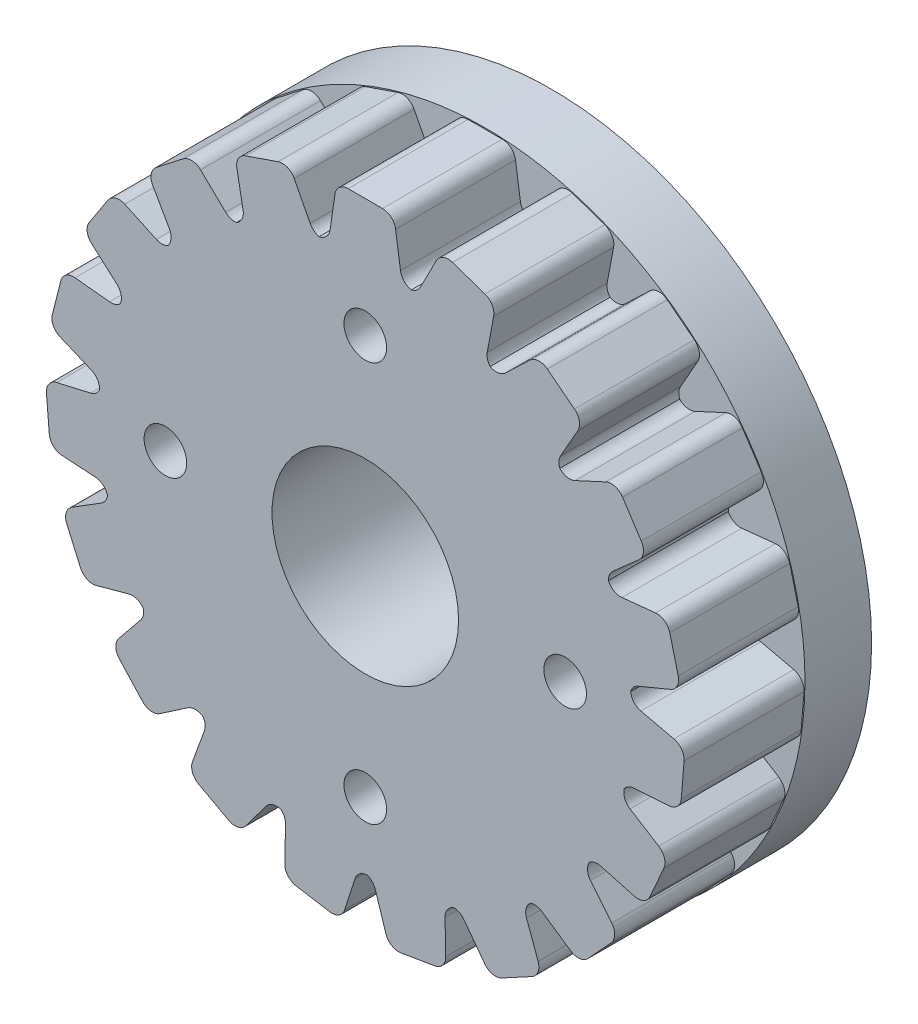
from build123d import *

# Parameters (mm, degrees)
SZKIC5_R                    = 24
DODANIE_WYCI_GNI_CIE3_DEPTH = 5
SZKIC6_R                    = 20
DODANIE_WYCI_GNI_CIE4_DEPTH = 9
DODANIE_WYCI_GNI_CIE5_REACH = 38.715
ZAOKR_GLENIE2_R             = 1
SZYK_START                  = 5
SZYK_KO_OWY3_DEPTH          = 9
SZKIC8_R                    = 7
WYTNIJ_WYCI_GNI_CIE3_DEPTH  = 10
SZKIC9_R                    = 1.6
WYTNIJ_WYCI_GNI_CIE4_DEPTH  = 37.71511967


# Read off the part's stored shape, not the designer's step: Szyk kołowy3
with BuildPart() as part:
    # Szkic5 → Dodanie-wyciągnięcie3 (new body)
    with BuildSketch(Plane.XY):
        Circle(SZKIC5_R)
    extrude(amount=DODANIE_WYCI_GNI_CIE3_DEPTH)

    # Szkic6 → Dodanie-wyciągnięcie4 (add)
    with BuildSketch(Plane.XY.offset(5)):
        Circle(SZKIC6_R)
    extrude(amount=DODANIE_WYCI_GNI_CIE4_DEPTH)

    # Szkic7 → Dodanie-wyciągnięcie5 (add, up to next)
    with BuildSketch(Plane.XY.offset(14), mode=Mode.PRIVATE) as dodanie_wyci_gni_cie5_sk1:
        with BuildLine():
            Line((-2.15, 23.903503927), (-2.75, 19.810035336))
            ThreePointArc((-2.75, 19.810035336), (0, 20), (2.75, 19.810035336))
            Line((2.75, 19.810035336), (2.15, 23.903503927))
            Line((2.15, 23.903503927), (-2.15, 23.903503927))
        make_face()
    dodanie_wyci_gni_cie5_tool1 = extrude(dodanie_wyci_gni_cie5_sk1.sketch, amount=-DODANIE_WYCI_GNI_CIE5_REACH, mode=Mode.PRIVATE) - part.part
    add(dodanie_wyci_gni_cie5_tool1.solids().sort_by_distance((0, 21.841189, 14))[0])

    # Zaokrąglenie2
    zaokr_glenie2_edges = [part.edges().sort_by_distance(p)[0] for p in [
        (-2.75, 19.810035336, 9.5),
        (-2.15, 23.903503927, 9.5),
        (2.15, 23.903503927, 9.5),
        (2.75, 19.810035336, 9.5),
    ]]
    fillet(zaokr_glenie2_edges, radius=ZAOKR_GLENIE2_R)

    # Szyk kołowy3 outline → Szyk kołowy3 (add)
    with BuildSketch(Plane.XY.offset(SZYK_START)):
        with BuildLine():
            ThreePointArc((3.459684979, 19.698491817), (6.493989384, 18.916344834), (9.368886528, 17.669860363))
            ThreePointArc((9.368886528, 17.669860363), (9.169998139, 18.057665281), (9.15495486, 18.493237257))
            Line((9.15495486, 18.493237257), (9.635880102, 21.060901891))
            ThreePointArc((9.635880102, 21.060901891), (9.517053985, 21.74835298), (8.97767191, 22.190818372))
            Line((8.97767191, 22.190818372), (6.545238164, 23.025873931))
            ThreePointArc((6.545238164, 23.025873931), (5.84782205, 23.008001894), (5.33181035, 22.538490903))
            Line((5.33181035, 22.538490903), (4.13423568, 20.216852329))
            ThreePointArc((4.13423568, 20.216852329), (3.854830575, 19.882364611), (3.459684979, 19.698491817))
        make_face()
        with BuildLine():
            ThreePointArc((9.368886528, 17.669860363), (12.149470554, 15.886798459), (14.598648694, 13.670386107))
            ThreePointArc((14.598648694, 13.670386107), (14.536456678, 14.10175764), (14.663658475, 14.518613669))
            Line((14.663658475, 14.518613669), (15.952245205, 16.79099898))
            ThreePointArc((15.952245205, 16.79099898), (16.063072418, 17.47978485), (15.696583829, 18.073413319))
            Line((15.696583829, 18.073413319), (13.66708815, 19.653033212))
            ThreePointArc((13.66708815, 19.653033212), (13.001656924, 19.862580173), (12.361154192, 19.586057308))
            Line((12.361154192, 19.586057308), (10.5290521, 17.831188775))
            ThreePointArc((10.5290521, 17.831188775), (9.975061969, 17.562883724), (9.368886528, 17.669860363))
        make_face()
        with BuildLine():
            ThreePointArc((14.598648694, 13.670386107), (16.649613754, 11.081081258), (18.246420753, 8.189513398))
            ThreePointArc((18.246420753, 8.189513398), (18.32766458, 8.617705746), (18.583327164, 8.97067301))
            Line((18.583327164, 8.97067301), (20.539937014, 10.70153079))
            ThreePointArc((20.539937014, 10.70153079), (20.86840771, 11.317010804), (20.714527333, 11.997473496))
            Line((20.714527333, 11.997473496), (19.307897069, 14.150481395))
            ThreePointArc((19.307897069, 14.150481395), (18.746560529, 14.56473969), (18.050975173, 14.511170494))
            Line((18.050975173, 14.511170494), (15.748336546, 13.446268155))
            ThreePointArc((15.748336546, 13.446268155), (15.13724462, 13.372380914), (14.598648694, 13.670386107))
        make_face()
        with BuildLine():
            ThreePointArc((18.246420753, 8.189513398), (19.345512959, 5.074556962), (19.916910001, 1.82117984))
            ThreePointArc((19.916910001, 1.82117984), (20.132785641, 2.199791718), (20.489204005, 2.450620736))
            Line((20.489204005, 2.450620736), (22.901807939, 3.452385688))
            ThreePointArc((22.901807939, 3.452385688), (23.41232722, 3.927863037), (23.487730381, 4.62142126))
            Line((23.487730381, 4.62142126), (22.856395746, 7.114505352))
            ThreePointArc((22.856395746, 7.114505352), (22.459983417, 7.688583667), (21.784692905, 7.863773193))
            Line((21.784692905, 7.863773193), (19.261044366, 7.60423574))
            ThreePointArc((19.261044366, 7.60423574), (18.659071938, 7.732773138), (18.246420753, 8.189513398))
        make_face()
        with BuildLine():
            ThreePointArc((19.916910001, 1.82117984), (19.945025658, -1.481874321), (19.429093008, -4.744506813))
            ThreePointArc((19.429093008, -4.744506813), (19.756206986, -4.456503876), (20.174757669, -4.334994319))
            Line((20.174757669, -4.334994319), (22.781912615, -4.170878973))
            ThreePointArc((22.781912615, -4.170878973), (23.419157796, -3.886929638), (23.715673393, -3.255433679))
            Line((23.715673393, -3.255433679), (23.928049292, -0.692437738))
            ThreePointArc((23.928049292, -0.692437738), (23.7395186, -0.020749698), (23.157701137, 0.364214048))
            Line((23.157701137, 0.364214048), (20.686519163, 0.938166391))
            ThreePointArc((20.686519163, 0.938166391), (20.158899287, 1.255199406), (19.916910001, 1.82117984))
        make_face()
        with BuildLine():
            ThreePointArc((19.429093008, -4.744506813), (18.383185348, -7.877721527), (16.835832314, -10.796052534))
            ThreePointArc((16.835832314, -10.796052534), (17.238736755, -10.629868126), (17.674063296, -10.650845476))
            Line((17.674063296, -10.650845476), (20.193243562, -11.342164179))
            ThreePointArc((20.193243562, -11.342164179), (20.888159239, -11.280513175), (21.373655206, -10.779511866))
            Line((21.373655206, -10.779511866), (22.406727414, -8.424344456))
            ThreePointArc((22.406727414, -8.424344456), (22.446508585, -7.727834511), (22.021213121, -7.174813341))
            Line((22.021213121, -7.174813341), (19.870288625, -5.829567843))
            ThreePointArc((19.870288625, -5.829567843), (19.4741971, -5.358394659), (19.429093008, -4.744506813))
        make_face()
        with BuildLine():
            ThreePointArc((16.835832314, -10.796052534), (14.829241661, -13.41989537), (12.418147953, -15.677678445))
            ThreePointArc((12.418147953, -15.677678445), (12.853181909, -15.651321225), (13.258109923, -15.812512261))
            Line((13.258109923, -15.812512261), (15.416323238, -17.284349905))
            ThreePointArc((15.416323238, -17.284349905), (16.093604516, -17.451678074), (16.715469831, -17.13546268))
            Line((16.715469831, -17.13546268), (18.457288945, -15.243342734))
            ThreePointArc((18.457288945, -15.243342734), (18.721071072, -14.597488544), (18.49838497, -13.936338376))
            Line((18.49838497, -13.936338376), (16.900803994, -11.965577947))
            ThreePointArc((16.900803994, -11.965577947), (16.679163484, -11.391323517), (16.835832314, -10.796052534))
        make_face()
        with BuildLine():
            ThreePointArc((12.418147953, -15.677678445), (9.668319541, -17.507815319), (6.654764575, -18.860384632))
            ThreePointArc((6.654764575, -18.860384632), (7.074785367, -18.976710813), (7.40543462, -19.260647986))
            Line((7.40543462, -19.260647986), (8.968805082, -21.353508124))
            ThreePointArc((8.968805082, -21.353508124), (9.555058025, -21.731682863), (10.245903933, -21.634520229))
            Line((10.245903933, -21.634520229), (12.507716825, -20.410488303))
            ThreePointArc((12.507716825, -20.410488303), (12.966915021, -19.885278191), (12.970969775, -19.187644903))
            Line((12.970969775, -19.187644903), (12.099855008, -16.804932016))
            ThreePointArc((12.099855008, -16.804932016), (12.0766837, -16.189825718), (12.418147953, -15.677678445))
        make_face()
        with BuildLine():
            ThreePointArc((6.654764575, -18.860384632), (3.459684979, -19.698491817), (0.170234196, -19.999275495))
            ThreePointArc((0.170234196, -19.999275495), (0.529726053, -20.245679332), (0.750265568, -20.621593642))
            Line((0.750265568, -20.621593642), (1.549377731, -23.108682404))
            ThreePointArc((1.549377731, -23.108682404), (1.981072735, -23.656722612), (2.666035361, -23.789141817))
            Line((2.666035361, -23.789141817), (5.202739509, -23.365840762))
            ThreePointArc((5.202739509, -23.365840762), (5.807592525, -23.018189394), (6.037948739, -22.359672378))
            Line((6.037948739, -22.359672378), (5.987698983, -19.823210944))
            ThreePointArc((5.987698983, -19.823210944), (6.165507849, -19.233909092), (6.654764575, -18.860384632))
        make_face()
        with BuildLine():
            ThreePointArc((0.170234196, -19.999275495), (-3.123860133, -19.754531072), (-6.3327437, -18.970934538))
            ThreePointArc((-6.3327437, -18.970934538), (-6.072737298, -19.32071435), (-5.986206399, -19.747869649))
            Line((-5.986206399, -19.747869649), (-6.037948739, -22.359672378))
            ThreePointArc((-6.037948739, -22.359672378), (-5.807592525, -23.018189394), (-5.202739509, -23.365840762))
            Line((-5.202739509, -23.365840762), (-2.666035361, -23.789141817))
            ThreePointArc((-2.666035361, -23.789141817), (-1.981072735, -23.656722612), (-1.549377731, -23.108682404))
            Line((-1.549377731, -23.108682404), (-0.773317135, -20.693337379))
            ThreePointArc((-0.773317135, -20.693337379), (-0.413796445, -20.19369997), (0.170234196, -19.999275495))
        make_face()
        with BuildLine():
            ThreePointArc((-6.3327437, -18.970934538), (-9.368886528, -17.669860363), (-12.149470554, -15.886798459))
            ThreePointArc((-12.149470554, -15.886798459), (-12.017125335, -16.302050177), (-12.073980018, -16.734157561))
            Line((-12.073980018, -16.734157561), (-12.970969775, -19.187644903))
            ThreePointArc((-12.970969775, -19.187644903), (-12.966915021, -19.885278191), (-12.507716825, -20.410488303))
            Line((-12.507716825, -20.410488303), (-10.245903933, -21.634520229))
            ThreePointArc((-10.245903933, -21.634520229), (-9.555058025, -21.731682863), (-8.968805082, -21.353508124))
            Line((-8.968805082, -21.353508124), (-7.450532343, -19.321019618))
            ThreePointArc((-7.450532343, -19.321019618), (-6.948259474, -18.96519012), (-6.3327437, -18.970934538))
        make_face()
        with BuildLine():
            ThreePointArc((-12.149470554, -15.886798459), (-14.598648694, -13.670386107), (-16.649613754, -11.081081258))
            ThreePointArc((-16.649613754, -11.081081258), (-16.659271377, -11.516805914), (-16.853350554, -11.907039843))
            Line((-16.853350554, -11.907039843), (-18.49838497, -13.936338376))
            ThreePointArc((-18.49838497, -13.936338376), (-18.721071072, -14.597488544), (-18.457288945, -15.243342734))
            Line((-18.457288945, -15.243342734), (-16.715469831, -17.13546268))
            ThreePointArc((-16.715469831, -17.13546268), (-16.093604516, -17.451678074), (-15.416323238, -17.284349905))
            Line((-15.416323238, -17.284349905), (-13.320366764, -15.854969585))
            ThreePointArc((-13.320366764, -15.854969585), (-12.729770776, -15.681507644), (-12.149470554, -15.886798459))
        make_face()
        with BuildLine():
            ThreePointArc((-16.649613754, -11.081081258), (-18.246420753, -8.189513399), (-19.345512959, -5.074556962))
            ThreePointArc((-19.345512959, -5.074556962), (-19.49612687, -5.48353703), (-19.806399052, -5.789609602))
            Line((-19.806399052, -5.789609602), (-22.021213121, -7.174813341))
            ThreePointArc((-22.021213121, -7.174813341), (-22.446508585, -7.727834511), (-22.406727414, -8.424344456))
            Line((-22.406727414, -8.424344456), (-21.373655206, -10.779511866))
            ThreePointArc((-21.373655206, -10.779511866), (-20.888159239, -11.280513175), (-20.193243562, -11.342164179))
            Line((-20.193243562, -11.342164179), (-17.74673276, -10.670787582))
            ThreePointArc((-17.74673276, -10.670787582), (-17.131813891, -10.698490492), (-16.649613754, -11.081081258))
        make_face()
        with BuildLine():
            ThreePointArc((-19.345512959, -5.074556962), (-19.916910001, -1.82117984), (-19.945025658, 1.481874321))
            ThreePointArc((-19.945025658, 1.481874321), (-20.220274503, 1.143958178), (-20.613116884, 0.955214675))
            Line((-20.613116884, 0.955214675), (-23.157701137, 0.364214048))
            ThreePointArc((-23.157701137, 0.364214048), (-23.7395186, -0.020749698), (-23.928049292, -0.692437738))
            Line((-23.928049292, -0.692437738), (-23.715673393, -3.255433679))
            ThreePointArc((-23.715673393, -3.255433679), (-23.419157796, -3.886929638), (-22.781912615, -4.170878973))
            Line((-22.781912615, -4.170878973), (-20.249964892, -4.330260171))
            ThreePointArc((-20.249964892, -4.330260171), (-19.677359144, -4.55612589), (-19.345512959, -5.074556962))
        make_face()
        with BuildLine():
            ThreePointArc((-19.945025658, 1.481874321), (-19.429093008, 4.744506813), (-18.383185348, 7.877721527))
            ThreePointArc((-18.383185348, 7.877721527), (-18.753241644, 7.647487767), (-19.186083656, 7.59652662))
            Line((-19.186083656, 7.59652662), (-21.784692905, 7.863773193))
            ThreePointArc((-21.784692905, 7.863773193), (-22.459983417, 7.688583667), (-22.856395746, 7.114505352))
            Line((-22.856395746, 7.114505352), (-23.487730381, 4.62142126))
            ThreePointArc((-23.487730381, 4.62142126), (-23.41232722, 3.927863037), (-22.901807939, 3.452385688))
            Line((-22.901807939, 3.452385688), (-20.558799117, 2.479518121))
            ThreePointArc((-20.558799117, 2.479518121), (-20.090557207, 2.079965647), (-19.945025658, 1.481874321))
        make_face()
        with BuildLine():
            ThreePointArc((-18.383185348, 7.877721527), (-16.835832314, 10.796052534), (-14.829241662, 13.419895371))
            ThreePointArc((-14.829241662, 13.419895371), (-15.254004065, 13.322293393), (-15.679940561, 13.414637033))
            Line((-15.679940561, 13.414637033), (-18.050975173, 14.511170494))
            ThreePointArc((-18.050975173, 14.511170494), (-18.746560529, 14.56473969), (-19.307897069, 14.150481395))
            Line((-19.307897069, 14.150481395), (-20.714527333, 11.997473496))
            ThreePointArc((-20.714527333, 11.997473496), (-20.86840771, 11.317010804), (-20.539937014, 10.70153079))
            Line((-20.539937014, 10.70153079), (-18.639768456, 9.020602151))
            ThreePointArc((-18.639768456, 9.020602151), (-18.326631661, 8.490660632), (-18.383185348, 7.877721527))
        make_face()
        with BuildLine():
            ThreePointArc((-14.829241662, 13.419895371), (-12.418147954, 15.677678445), (-9.668319541, 17.50781532))
            ThreePointArc((-9.668319541, 17.50781532), (-10.101758457, 17.553421813), (-10.474632608, 17.779063375))
            Line((-10.474632608, 17.779063375), (-12.361154192, 19.586057308))
            ThreePointArc((-12.361154192, 19.586057308), (-13.001656924, 19.862580173), (-13.66708815, 19.653033212))
            Line((-13.66708815, 19.653033212), (-15.696583829, 18.073413319))
            ThreePointArc((-15.696583829, 18.073413319), (-16.063072418, 17.47978485), (-15.952245205, 16.79099898))
            Line((-15.952245205, 16.79099898), (-14.700829657, 14.584163969))
            ThreePointArc((-14.700829657, 14.584163969), (-14.576731206, 13.981260792), (-14.829241662, 13.419895371))
        make_face()
        with BuildLine():
            Line((-9.635880102, 21.060901891), (-9.168827857, 18.567305324))
            ThreePointArc((-9.168827857, 18.567305324), (-9.247215745, 17.956774403), (-9.668319541, 17.507815319))
            ThreePointArc((-9.668319541, 17.507815319), (-6.654764575, 18.860384632), (-3.459684979, 19.698491817))
            ThreePointArc((-3.459684979, 19.698491817), (-3.854830575, 19.882364611), (-4.13423568, 20.216852329))
            Line((-4.13423568, 20.216852329), (-5.33181035, 22.538490903))
            ThreePointArc((-5.33181035, 22.538490903), (-5.84782205, 23.008001894), (-6.545238164, 23.025873931))
            Line((-6.545238164, 23.025873931), (-8.97767191, 22.190818372))
            ThreePointArc((-8.97767191, 22.190818372), (-9.517053985, 21.74835298), (-9.635880102, 21.060901891))
        make_face()
    extrude(amount=SZYK_KO_OWY3_DEPTH)

    # Szkic8 → Wytnij-wyciągnięcie3 (cut)
    with BuildSketch(Plane.XY.offset(14)):
        Circle(SZKIC8_R)
    extrude(amount=-WYTNIJ_WYCI_GNI_CIE3_DEPTH, mode=Mode.SUBTRACT)

    # Szkic9 → Wytnij-wyciągnięcie4 (cut, through all)
    with BuildSketch(Plane.XY.offset(14)):
        with Locations((0, 15)):
            Circle(SZKIC9_R)
        with Locations((15, 0)):
            Circle(SZKIC9_R)
        with Locations((0, -15)):
            Circle(SZKIC9_R)
        with Locations((-15, 0)):
            Circle(SZKIC9_R)
    extrude(amount=-WYTNIJ_WYCI_GNI_CIE4_DEPTH, mode=Mode.SUBTRACT)


solid = part.part
